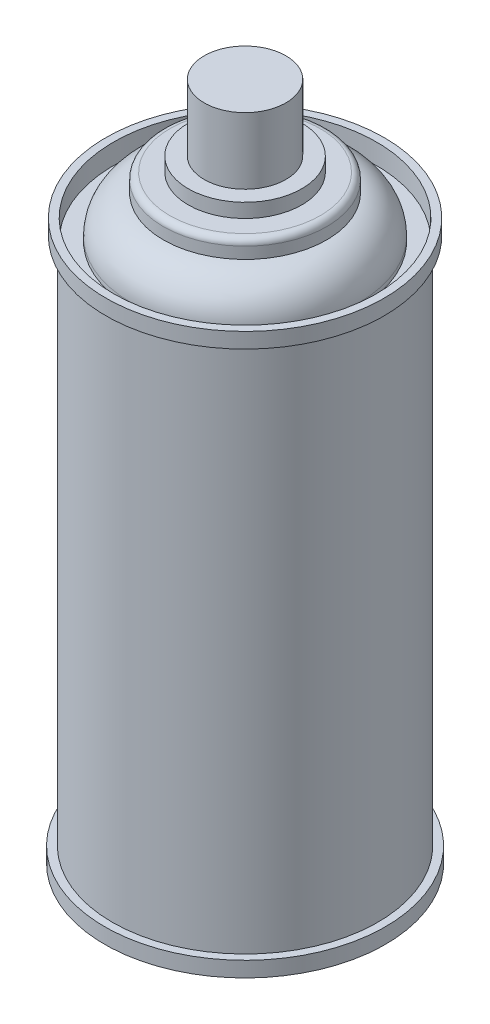
from build123d import *

# Parameters (mm, degrees)
SKETCH1_R           = 27.94
BOSS_EXTRUDE1_DEPTH = 3.048
SKETCH2_R           = 26.416
BOSS_EXTRUDE2_DEPTH = 105.156
SKETCH3_R           = 27.686
BOSS_EXTRUDE3_DEPTH = 3.048
SKETCH4_R           = 26.162
CUT_EXTRUDE1_DEPTH  = 4.064
SKETCH5_R           = 22.733
BOSS_EXTRUDE4_DEPTH = 8.382
SKETCH6_R           = 16.256
BOSS_EXTRUDE5_DEPTH = 3.556
SKETCH7_R           = 11.303
BOSS_EXTRUDE6_DEPTH = 2.794
SKETCH8_R           = 8.128
BOSS_EXTRUDE7_DEPTH = 13.208
FILLET1_R           = 7.62
FILLET2_R           = 1.27


with BuildPart() as part:
    # Sketch1 → Boss-Extrude1 (new body)
    with BuildSketch(Plane(origin=(0, 0, 0), x_dir=(1, 0, 0), z_dir=(0, 1, 0))):
        with Locations(Location((0, 0, 0), (0, 0, 90))):
            Circle(SKETCH1_R)
    extrude(amount=BOSS_EXTRUDE1_DEPTH)

    # Sketch2 → Boss-Extrude2 (add)
    with BuildSketch(Plane(origin=(0, 3.048, 0), x_dir=(1, 0, 0), z_dir=(0, 1, 0))):
        with Locations(Location((0, 0, 0), (0, 0, 270))):
            Circle(SKETCH2_R)
    extrude(amount=BOSS_EXTRUDE2_DEPTH)

    # Sketch3 → Boss-Extrude3 (add)
    with BuildSketch(Plane(origin=(0, 108.204, 0), x_dir=(1, 0, 0), z_dir=(0, 1, 0))):
        with Locations(Location((0, 0, 0), (0, 0, 90))):
            Circle(SKETCH3_R)
    extrude(amount=BOSS_EXTRUDE3_DEPTH)

    # Sketch4 → Cut-Extrude1 (cut)
    with BuildSketch(Plane(origin=(0, 111.252, 0), x_dir=(1, 0, 0), z_dir=(0, 1, 0))):
        with Locations(Location((0, 0, 0), (0, 0, 270))):
            Circle(SKETCH4_R)
    extrude(amount=-CUT_EXTRUDE1_DEPTH, mode=Mode.SUBTRACT)

    # Sketch5 → Boss-Extrude4 (add)
    with BuildSketch(Plane(origin=(0, 107.188, 0), x_dir=(1, 0, 0), z_dir=(0, 1, 0))):
        with Locations(Location((0, 0, 0), (0, 0, 270))):
            Circle(SKETCH5_R)
    extrude(amount=BOSS_EXTRUDE4_DEPTH)

    # Sketch6 → Boss-Extrude5 (add)
    with BuildSketch(Plane(origin=(0, 115.57, 0), x_dir=(1, 0, 0), z_dir=(0, 1, 0))):
        with Locations(Location((0, 0, 0), (0, 0, 270))):
            Circle(SKETCH6_R)
    extrude(amount=BOSS_EXTRUDE5_DEPTH)

    # Sketch7 → Boss-Extrude6 (add)
    with BuildSketch(Plane(origin=(0, 119.126, 0), x_dir=(1, 0, 0), z_dir=(0, 1, 0))):
        with Locations(Location((0, 0, 0), (0, 0, 270))):
            Circle(SKETCH7_R)
    extrude(amount=BOSS_EXTRUDE6_DEPTH)

    # Sketch8 → Boss-Extrude7 (add)
    with BuildSketch(Plane(origin=(0, 121.92, 0), x_dir=(1, 0, 0), z_dir=(0, 1, 0))):
        with Locations(Location((0, 0, 0), (0, 0, 90))):
            Circle(SKETCH8_R)
    extrude(amount=BOSS_EXTRUDE7_DEPTH)

    # Fillet1
    # the kernel refuses this fillet: 7.62 mm, written as the material it takes off along each edge
    with BuildSketch(Plane(origin=(0, 115.57, 0), x_dir=(0, 0, 1), z_dir=(-1, 0, 0))) as fillet1_piece_1:
        with BuildLine():
            CenterArc((15.113, -7.533787295), FILLET1_R, 0, 81.373073441)
            Line((16.256, 0), (16.27886, 0.150675746))
            ThreePointArc((16.27886, 0.150675746), (19.4945, 0.1524), (22.733, 0.1524))
            Line((22.733, 0.1524), (22.8854, 0))
            Line((22.8854, 0), (22.8854, -7.533787295))
            Line((22.8854, -7.533787295), (22.733, -7.533787295))
        make_face()
    revolve(axis=Axis((0, 115.57, 0), (0, 1, 0)), mode=Mode.SUBTRACT)

    # Fillet2
    fillet2_edges = [part.edges().sort_by_distance(p)[0] for p in [
        (0, 119.126, -16.256),
    ]]
    fillet(fillet2_edges, radius=FILLET2_R)


solid = part.part
